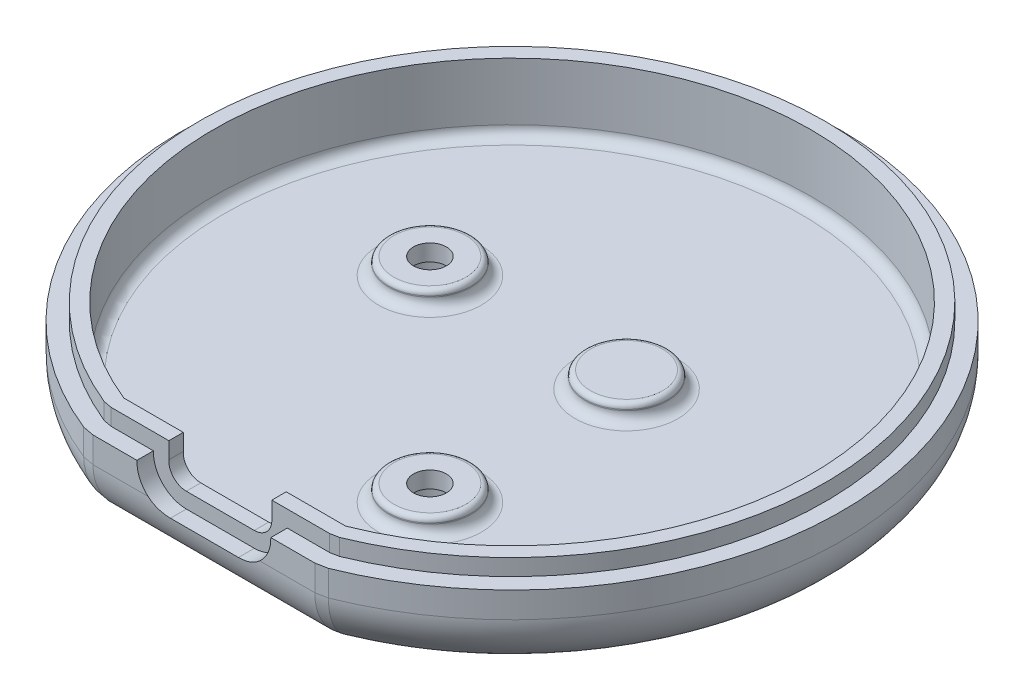
from build123d import *

# Parameters (mm, degrees)
BOSS_EXTRUDE1_DEPTH = 25
BOSS_EXTRUDE2_START = -3
BOSS_EXTRUDE2_DEPTH = 3
BOSS_EXTRUDE3_DEPTH = 3
CUT_EXTRUDE1_DEPTH  = 3
FILLET1_R           = 5.5
FILLET2_R           = 2
SKETCH6_R           = 4
SKETCH6_R_2         = 1.6
BOSS_EXTRUDE4_DEPTH = 1.6
FILLET3_R           = 1
FILLET4_R           = 0.5
CUT_EXTRUDE2_START  = -3
SKETCH7_R           = 1.6
CUT_EXTRUDE2_DEPTH  = 3
FILLET5_R           = 1
CUT_EXTRUDE3_START  = -17
CUT_EXTRUDE3_DEPTH  = 17
BOSS_EXTRUDE5_DEPTH = 1.6
CUT_EXTRUDE4_START  = -1.6
CUT_EXTRUDE4_DEPTH  = 1.6
SKETCH12_R          = 3.1
CUT_EXTRUDE5_DEPTH  = 3
CUT_EXTRUDE6_DEPTH  = 1.6


with BuildPart() as part:
    # Sketch1 → Boss-Extrude1 (new body)
    with BuildSketch(Plane(origin=(0, 0, 0), x_dir=(1, 0, 0), z_dir=(0, 1, 0))):
        with BuildLine():
            ThreePointArc((-11.883644272, -28.785462223), (0, 32.92613482), (11.883644272, -28.785462223))
            Line((11.883644272, -28.785462223), (10.769552622, -29))
            Line((10.769552622, -29), (-10.769552622, -29))
            Line((-10.769552622, -29), (-11.883644272, -28.785462223))
        make_face()
        with BuildLine():
            Line((-10.769552622, -26), (10.769552622, -26))
            ThreePointArc((10.769552622, -26), (0, 29.92613482), (-10.769552622, -26))
        make_face(mode=Mode.SUBTRACT)
    extrude(amount=BOSS_EXTRUDE1_DEPTH)

    # Sketch2 → Boss-Extrude2 (add)
    with BuildSketch(Plane(origin=(0, 25, 0), x_dir=(1, 0, 0), z_dir=(0, 1, 0)).offset(BOSS_EXTRUDE2_START)):
        with BuildLine():
            Line((10.769552622, -29), (11.883644272, -28.785462223))
            ThreePointArc((11.883644272, -28.785462223), (0, 32.92613482), (-11.883644272, -28.785462223))
            Line((-11.883644272, -28.785462223), (-10.769552622, -29))
            Line((-10.769552622, -29), (10.769552622, -29))
        make_face()
    extrude(amount=BOSS_EXTRUDE2_DEPTH)

    # Sketch3 → Boss-Extrude3 (add)
    with BuildSketch(Plane.XZ):
        with BuildLine():
            Line((10.769552622, 29), (11.883644272, 28.785462223))
            ThreePointArc((11.883644272, 28.785462223), (0, -32.92613482), (-11.883644272, 28.785462223))
            Line((-11.883644272, 28.785462223), (-10.769552622, 29))
            Line((-10.769552622, 29), (10.769552622, 29))
        make_face()
    extrude(amount=-BOSS_EXTRUDE3_DEPTH)

    # Sketch5 → Cut-Extrude1 (cut)
    with BuildSketch(Plane.XY.offset(29)):
        with BuildLine():
            Line((-3.3, 9.6), (3.3, 9.6))
            ThreePointArc((3.3, 9.6), (5, 7.9), (3.3, 6.2))
            Line((3.3, 6.2), (-3.3, 6.2))
            ThreePointArc((-3.3, 6.2), (-5, 7.9), (-3.3, 9.6))
        make_face()
    extrude(amount=-CUT_EXTRUDE1_DEPTH, mode=Mode.SUBTRACT)

    # Fillet1
    # the kernel refuses this fillet: 5.5 mm, written as the material it takes off along each edge
    with BuildSketch(Plane(origin=(2.732385211, 0, 31.600033606), x_dir=(0.18909335316754428, 0, -0.9819591151304897), z_dir=(-0.9819591151304897, 0, -0.1890933531675443)), Plane(origin=(25.385582105, 0, 26.185428617), x_dir=(-0.1890933531675464, 0, -0.9819591151304894), z_dir=(-0.9819591151304893, 0, 0.18909335316754644))) as fillet1_piece_1:
        with BuildLine():
            CenterArc((FILLET1_R, -FILLET1_R), FILLET1_R, 90, 90)
            Line((0, -FILLET1_R), (0, 0))
            Line((0, 0), (FILLET1_R, 0))
        make_face()
    extrude(amount=28.634560119, mode=Mode.SUBTRACT)
    with BuildSketch(Plane(origin=(0, 0, -0.92613482), x_dir=(-0.0031415874858790054, 0, 0.9999950652018582), z_dir=(0.9999950652018582, 0, 0.0031415874858790054))) as fillet1_piece_2:
        with BuildLine():
            CenterArc((32 - FILLET1_R, -FILLET1_R), FILLET1_R, 0, 90)
            Line((32 - FILLET1_R, 0), (32, 0))
            Line((32, 0), (32, -FILLET1_R))
        make_face()
    revolve(axis=Axis((0, 0, -0.92613482), (0, -1, 0)), revolution_arc=359.64, mode=Mode.SUBTRACT)
    with BuildSketch(Plane(origin=(24.519552622, 0, 29), x_dir=(0, 0, -1), z_dir=(-1, 0, 0))) as fillet1_piece_3:
        with BuildLine():
            CenterArc((FILLET1_R, -FILLET1_R), FILLET1_R, 90, 90)
            Line((0, -FILLET1_R), (0, 0))
            Line((0, 0), (FILLET1_R, 0))
        make_face()
    extrude(amount=49.039105243, mode=Mode.SUBTRACT)

    # Fillet2
    fillet2_edges = [part.edges().sort_by_distance(p)[0] for p in [
        (-11.326598447, 25, 28.892731111),
        (0, 25, 29),
        (11.326598447, 25, 28.892731111),
        (0, 25, -32.92613482),
    ]]
    fillet(fillet2_edges, radius=FILLET2_R)

    # Sketch6 → Boss-Extrude4 (add)
    # profile 1 of 3: a face of its own
    with BuildSketch(Plane(origin=(0, 3, 0), x_dir=(1, 0, 0), z_dir=(0, 1, 0))):
        with Locations(Location((-12.821883092, 5.771883092, 0), (0, 0, 90))):
            Circle(SKETCH6_R)
        with Locations(Location((-12.821883092, 5.771883092, 0), (0, 0, 270))):
            Circle(SKETCH6_R_2, mode=Mode.SUBTRACT)
    # profile 2 of 3: a face of its own
    with BuildSketch(Plane(origin=(0, 3, 0), x_dir=(1, 0, 0), z_dir=(0, 1, 0))):
        with Locations(Location((6.27, 5.771883092, 0), (0, 0, 90))):
            Circle(SKETCH6_R)
    # profile 3 of 3: a face of its own
    with BuildSketch(Plane(origin=(0, 3, 0), x_dir=(1, 0, 0), z_dir=(0, 1, 0))):
        with Locations(Location((6.27, -13.32, 0), (0, 0, 90))):
            Circle(SKETCH6_R)
        with Locations(Location((6.27, -13.32, 0), (0, 0, 270))):
            Circle(SKETCH6_R_2, mode=Mode.SUBTRACT)
    extrude(amount=BOSS_EXTRUDE4_DEPTH)

    # Fillet3
    fillet3_edges = [part.edges().sort_by_distance(p)[0] for p in [
        (-12.821883092, 3, -1.771883092),
        (6.27, 3, -1.771883092),
        (6.27, 3, 17.32),
    ]]
    fillet(fillet3_edges, radius=FILLET3_R)

    # Fillet4
    fillet4_edges = [part.edges().sort_by_distance(p)[0] for p in [
        (-12.821883092, 4.6, -1.771883092),
        (6.27, 4.6, -1.771883092),
        (6.27, 4.6, 17.32),
    ]]
    fillet(fillet4_edges, radius=FILLET4_R)

    # Sketch7 → Cut-Extrude2 (cut)
    with BuildSketch(Plane(origin=(0, 3, 0), x_dir=(1, 0, 0), z_dir=(0, 1, 0)).offset(CUT_EXTRUDE2_START)):
        with Locations(Location((6.27, -13.32, 0), (0, 0, 270))):
            Circle(SKETCH7_R)
        with Locations(Location((-12.821883092, 5.771883092, 0), (0, 0, 270))):
            Circle(SKETCH7_R)
    extrude(amount=CUT_EXTRUDE2_DEPTH, mode=Mode.SUBTRACT)

    # Fillet5
    fillet5_edges = [part.edges().sort_by_distance(p)[0] for p in [
        (0, 3, 26),
        (0, 3, -29.92613482),
    ]]
    fillet(fillet5_edges, radius=FILLET5_R)

    # Sketch8 → Cut-Extrude3 (cut)
    with BuildSketch(Plane(origin=(0, 25, 0), x_dir=(1, 0, 0), z_dir=(0, 1, 0)).offset(CUT_EXTRUDE3_START)):
        with BuildLine():
            Line((11.883644272, -28.785462223), (10.769552622, -29))
            Line((10.769552622, -29), (-10.769552622, -29))
            Line((-10.769552622, -29), (-11.883644272, -28.785462223))
            ThreePointArc((-11.883644272, -28.785462223), (0, 32.92613482), (11.883644272, -28.785462223))
        make_face()
    extrude(amount=CUT_EXTRUDE3_DEPTH, mode=Mode.SUBTRACT)

    # Sketch9 → Boss-Extrude5 (add)
    with BuildSketch(Plane(origin=(0, 8, 0), x_dir=(1, 0, 0), z_dir=(0, 1, 0))):
        with BuildLine():
            Line((-4.997056275, -26), (-10.769552622, -26))
            ThreePointArc((-10.769552622, -26), (0, 29.92613482), (10.769552622, -26))
            Line((10.769552622, -26), (4.997056275, -26))
            Line((4.997056275, -26), (4.997056275, -29))
            Line((4.997056275, -29), (10.769552622, -29))
            Line((10.769552622, -29), (11.883644272, -28.785462223))
            ThreePointArc((11.883644272, -28.785462223), (0, 32.92613482), (-11.883644272, -28.785462223))
            Line((-11.883644272, -28.785462223), (-10.769552622, -29))
            Line((-10.769552622, -29), (-4.997056275, -29))
            Line((-4.997056275, -29), (-4.997056275, -26))
        make_face()
    extrude(amount=BOSS_EXTRUDE5_DEPTH)

    # Sketch11 → Cut-Extrude4 (cut)
    with BuildSketch(Plane(origin=(0, 9.6, 0), x_dir=(1, 0, 0), z_dir=(0, 1, 0)).offset(CUT_EXTRUDE4_START)):
        with BuildLine():
            ThreePointArc((11.883644272, -28.785462223), (0, 32.92613482), (-11.883644272, -28.785462223))
            Line((-11.883644272, -28.785462223), (-10.769552622, -29))
            Line((-10.769552622, -29), (-5, -29))
            Line((-5, -29), (-4.997056275, -29))
            Line((-4.997056275, -29), (-4.997056275, -27.4))
            Line((-4.997056275, -27.4), (-5, -27.4))
            Line((-5, -27.4), (-10.616900954, -27.4))
            Line((-10.616900954, -27.4), (-11.429257174, -27.243566642))
            ThreePointArc((-11.429257174, -27.243566642), (0, 31.32613482), (11.429257174, -27.243566642))
            Line((11.429257174, -27.243566642), (10.616900954, -27.4))
            Line((10.616900954, -27.4), (5, -27.4))
            Line((5, -27.4), (4.997056275, -27.4))
            Line((4.997056275, -27.4), (4.997056275, -29))
            Line((4.997056275, -29), (5, -29))
            Line((5, -29), (10.769552622, -29))
            Line((10.769552622, -29), (11.883644272, -28.785462223))
        make_face()
    extrude(amount=CUT_EXTRUDE4_DEPTH, mode=Mode.SUBTRACT)

    # Sketch12 → Cut-Extrude5 (cut)
    with BuildSketch(Plane.XZ):
        with Locations(Location((-12.821883092, -5.771883092, 0), (0, 0, 270))):
            Circle(SKETCH12_R)
        with Locations(Location((6.27, 13.32, 0), (0, 0, 270))):
            Circle(SKETCH12_R)
    extrude(amount=-CUT_EXTRUDE5_DEPTH, mode=Mode.SUBTRACT)

    # Sketch5<3> → Cut-Extrude6 (cut)
    with BuildSketch(Plane.XY.offset(29)):
        with BuildLine():
            Line((-3.3, 11.1), (3.3, 11.1))
            ThreePointArc((3.3, 11.1), (6.5, 7.9), (3.3, 4.7))
            Line((3.3, 4.7), (-3.3, 4.7))
            ThreePointArc((-3.3, 4.7), (-6.5, 7.9), (-3.3, 11.1))
        make_face()
        with BuildLine():
            Line((-3.3, 9.6), (3.3, 9.6))
            ThreePointArc((3.3, 9.6), (5, 7.9), (3.3, 6.2))
            Line((3.3, 6.2), (-3.3, 6.2))
            ThreePointArc((-3.3, 6.2), (-5, 7.9), (-3.3, 9.6))
        make_face(mode=Mode.SUBTRACT)
    extrude(amount=-CUT_EXTRUDE6_DEPTH, mode=Mode.SUBTRACT)


solid = part.part
